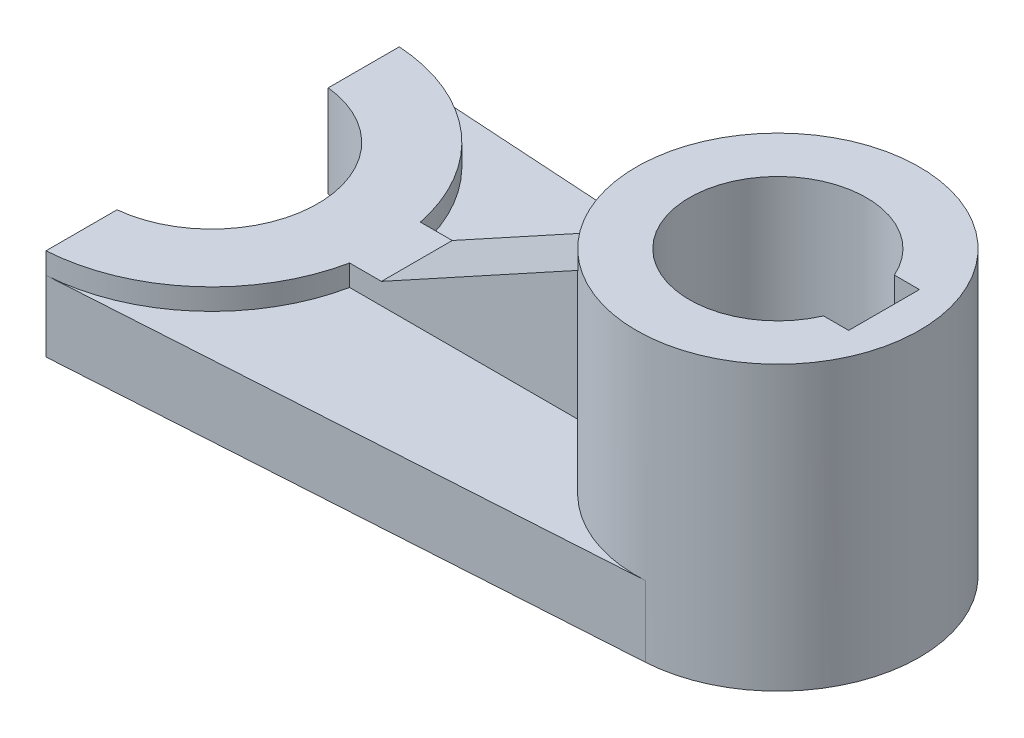
from build123d import *

# Parameters (mm, degrees)
SKETCH_1_R          = 20
EXTRUDE_1_DEPTH     = 10
EXTRUDE_2_DEPTH     = 3
SKETCH_7_R          = 20
EXTRUDE_3_DEPTH     = 30
RIB_START           = -5
RIB_1_DEPTH         = 10
CUT_EXTRUDE_1_DEPTH = 92.515026089


# Read off the part's stored shape, not the designer's step: 筋1
with BuildPart() as part:
    # 草图1 → 凸台-拉伸1 (new body)
    with BuildSketch(Plane(origin=(0, 0, 0), x_dir=(1, 0, 0), z_dir=(0, 1, 0))):
        with BuildLine():
            Line((1.25, 19.960899278), (-78.4375, 24.951124098))
            ThreePointArc((-78.4375, 24.951124098), (-61.778275329, 17.116329922), (-55, 0))
            ThreePointArc((-55, 0), (-61.778275329, -17.116329922), (-78.4375, -24.951124098))
            Line((-78.4375, -24.951124098), (1.25, -19.960899278))
            ThreePointArc((1.25, -19.960899278), (-20, 0), (1.25, 19.960899278))
        make_face()
        with BuildLine():
            ThreePointArc((-55, 0), (-61.778275329, 17.116329922), (-78.4375, 24.951124098))
            Line((-78.4375, 24.951124098), (-78.4375, 14.918397828))
            ThreePointArc((-78.4375, 14.918397828), (-68.854653437, 10.038986503), (-65, 0))
            ThreePointArc((-65, 0), (-68.854653437, -10.038986503), (-78.4375, -14.918397828))
            Line((-78.4375, -14.918397828), (-78.4375, -24.951124098))
            ThreePointArc((-78.4375, -24.951124098), (-61.778275329, -17.116329922), (-55, 0))
        make_face()
        Circle(SKETCH_1_R)
    extrude(amount=EXTRUDE_1_DEPTH)

    # 草图5 → 凸台-拉伸2 (add)
    with BuildSketch(Plane(origin=(0, 10, 0), x_dir=(1, 0, 0), z_dir=(0, 1, 0))):
        with BuildLine():
            ThreePointArc((-78.4375, 24.951124098), (-55, 0), (-78.4375, -24.951124098))
            Line((-78.4375, -24.951124098), (-78.4375, -14.918397828))
            ThreePointArc((-78.4375, -14.918397828), (-65, 0), (-78.4375, 14.918397828))
            Line((-78.4375, 14.918397828), (-78.4375, 24.951124098))
        make_face()
    extrude(amount=EXTRUDE_2_DEPTH)

    # 草图7 → 凸台-拉伸3 (add)
    with BuildSketch(Plane(origin=(0, 10, 0), x_dir=(1, 0, 0), z_dir=(0, 1, 0))):
        with Locations(Location((0, 0, 0), (0, 0, 86.416678302))):
            Circle(SKETCH_7_R)
    extrude(amount=EXTRUDE_3_DEPTH)

    # 筋1 outline → 筋1 (add)
    with BuildSketch(Plane.XY.offset(RIB_START)):
        Polygon((-19.364916731, 30.34827147), (-51, 13), (-57, 13), (-57, 10), (-18, 10), (-18, 31.096774193), align=None)
    extrude(amount=RIB_1_DEPTH)

    # 草图9 → 切除-拉伸1 (cut, through all)
    with BuildSketch(Plane(origin=(0, 40, 0), x_dir=(1, 0, 0), z_dir=(0, 1, 0))):
        with BuildLine():
            Line((0, -5), (0, 5))
            Line((0, 5), (11.456439237, 5))
            ThreePointArc((11.456439237, 5), (-12.5, 0), (11.456439237, -5))
            Line((11.456439237, -5), (0, -5))
        make_face()
        with BuildLine():
            Line((11.456439237, 5), (0, 5))
            Line((0, 5), (0, -5))
            Line((0, -5), (11.456439237, -5))
            ThreePointArc((11.456439237, -5), (12.236328912, -2.553870546), (12.5, 0))
            ThreePointArc((12.5, 0), (12.236328912, 2.553870546), (11.456439237, 5))
        make_face()
        with BuildLine():
            Line((15, 5), (11.456439237, 5))
            ThreePointArc((11.456439237, 5), (12.236328912, 2.553870546), (12.5, 0))
            ThreePointArc((12.5, 0), (12.236328912, -2.553870546), (11.456439237, -5))
            Line((11.456439237, -5), (15, -5))
            Line((15, -5), (15, 5))
        make_face()
    extrude(amount=-CUT_EXTRUDE_1_DEPTH, mode=Mode.SUBTRACT)


solid = part.part
